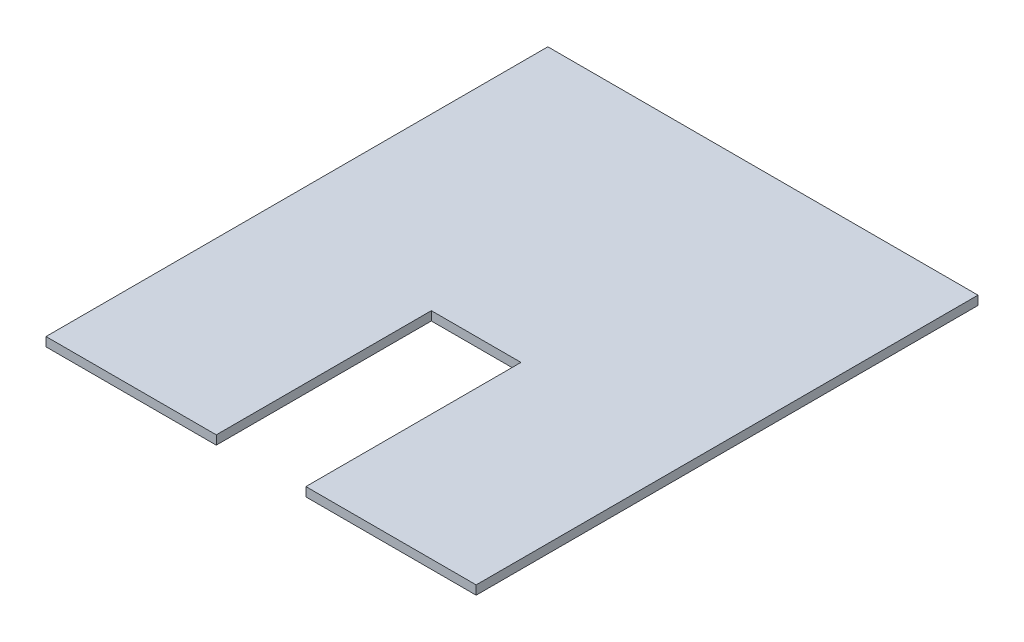
from build123d import *

# Parameters (mm, degrees)
SKETCH1_W           = 304.8
SKETCH1_H           = 355.6
BOSS_EXTRUDE1_DEPTH = 6.35
SKETCH2_W           = 63.5
SKETCH2_H           = 152.4
CUT_EXTRUDE1_DEPTH  = 235.26250767


with BuildPart() as part:
    # Sketch1 → Boss-Extrude1 (new body)
    with BuildSketch(Plane(origin=(0, 0, 0), x_dir=(1, 0, 0), z_dir=(0, 1, 0))):
        Rectangle(SKETCH1_W, SKETCH1_H)
    extrude(amount=BOSS_EXTRUDE1_DEPTH)

    # Sketch2 → Cut-Extrude1 (cut, through all)
    with BuildSketch(Plane(origin=(0, 6.35, 0), x_dir=(1, 0, 0), z_dir=(0, 1, 0))):
        with Locations((0, -101.6)):
            Rectangle(SKETCH2_W, SKETCH2_H)
    extrude(amount=-CUT_EXTRUDE1_DEPTH, mode=Mode.SUBTRACT)


solid = part.part
